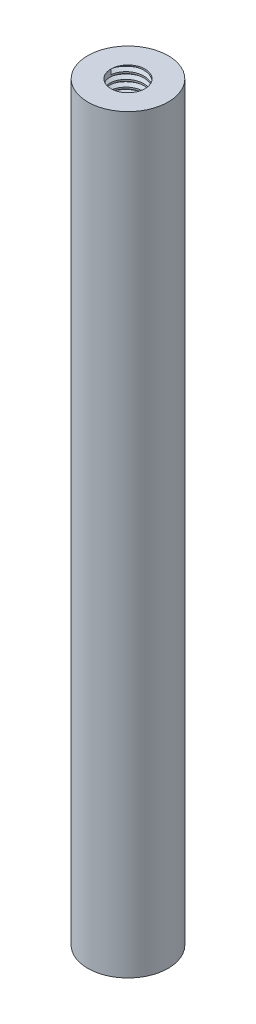
from build123d import *

# Parameters (mm, degrees)
SKETCH1_R           = 4.7625
SKETCH1_R_2         = 2.0193
BOSS_EXTRUDE1_DEPTH = 44.45
THREAD1_PITCH       = 0.79375


with BuildPart() as part:
    # Sketch1 → Boss-Extrude1 (new, symmetric)
    with BuildSketch(Plane(origin=(0, 0, 0), x_dir=(1, 0, 0), z_dir=(0, 1, 0))):
        with Locations(Location((0, 0, 0), (0, 0, 270))):
            Circle(SKETCH1_R)
        with Locations(Location((0, 0, 0), (0, 0, 270))):
            Circle(SKETCH1_R_2, mode=Mode.SUBTRACT)
    extrude(amount=BOSS_EXTRUDE1_DEPTH, both=True)

    # Thread1: the profile of Thread Profile2 profile screwed along a right-hand helix of 12 turns, 8 arcs to a turn; built about Z, then put on its axis
    thread1_z = Axis((0, 0, 0), (0, 0, 1))
    thread1_corners = [(2.019, 0, -0.000173205), (2.448929788, 0, 0.248046874), (2.448929788, 0, 0.347265624), (2.019, 0, 0.595485703)]
    with BuildLine(mode=Mode.PRIVATE) as thread1_profile:
        Line(thread1_corners[0], thread1_corners[1])
        Line(thread1_corners[1], thread1_corners[2])
        Line(thread1_corners[2], thread1_corners[3])
        Line(thread1_corners[3], thread1_corners[0])
    thread1_cap = Face(thread1_profile.wire())
    thread1_turn_angles = [0, 22.5, 45, 67.5, 90, 112.5, 135, 157.5, 180, 202.5, 225, 247.5, 270, 292.5, 315, 337.5, 360]
    thread1_turn_weights = [1, 0.9238795325112867, 1, 0.9238795325112867, 1, 0.9238795325112867, 1, 0.9238795325112867, 1, 0.9238795325112867, 1, 0.9238795325112867, 1, 0.9238795325112867, 1, 0.9238795325112867, 1]
    thread1_turn_rails = [Edge.make_bspline([Vector(p[0], p[1], 0).rotate(thread1_z, thread1_turn_angles[k]) / thread1_turn_weights[k] + Vector(0, 0, p[2] + THREAD1_PITCH * thread1_turn_angles[k] / 360) for k in range(17)], [0, 0, 0, 1, 1, 2, 2, 3, 3, 4, 4, 5, 5, 6, 6, 7, 7, 8, 8, 8], 2, thread1_turn_weights) for p in thread1_corners]
    thread1_turn_sides = [Face.make_surface_from_curves(thread1_turn_rails[p[0]], thread1_turn_rails[p[1]]) for p in [(0, 1), (1, 2), (2, 3), (3, 0)]]
    thread1 = Plane(origin=(0, 44.45, 0), x_dir=(-1, 0, 0), z_dir=(0, -1, 0)) * Solid(Shell([*[p.moved(Location((0, 0, THREAD1_PITCH * i))) for i in range(12) for p in thread1_turn_sides], thread1_cap, thread1_cap.rotate(thread1_z, 4320).moved(Location((0, 0, THREAD1_PITCH * 4320 / 360)))]))
    add(thread1, mode=Mode.SUBTRACT)

    # Mirror3: Thread1 across plane
    add(thread1.mirror(Plane.ZX), mode=Mode.SUBTRACT)


solid = part.part
